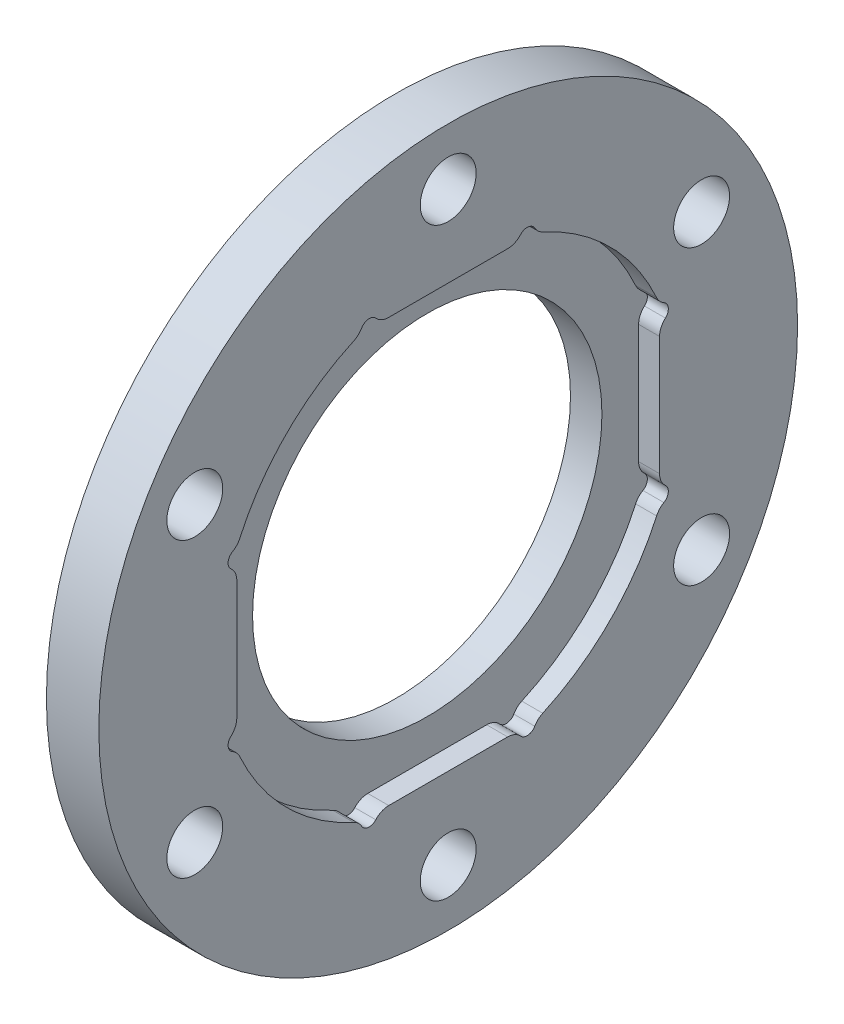
from build123d import *

# Parameters (mm, degrees)
SKETCH_3_R          = 20
EXTRUDE_3_DEPTH     = 3
SKETCH_4_R          = 13.1
CUT_EXTRUDE_1_DEPTH = 1.2
EXTRUDE_START       = 1.2
EXTRUDE_4_DEPTH     = 1.2
SKETCH_6_R          = 10
CUT_EXTRUDE_2_DEPTH = 29.341489022
SKETCH_7_R          = 1.6
CUT_EXTRUDE_4_DEPTH = 29.442925307
SKETCH_8_R          = 0.5
CUT_EXTRUDE_5_DEPTH = 1.2
FILLET_START        = 1.8
FILLET_1_DEPTH      = 2.2


with BuildPart() as part:
    # 草图3 → 凸台-拉伸3 (new body)
    with BuildSketch(Plane(origin=(0, 0, 0), x_dir=(0, 0, -1), z_dir=(1, 0, 0))):
        Circle(SKETCH_3_R)
    extrude(amount=EXTRUDE_3_DEPTH)

    # 草图4 → 切除-拉伸1 (cut)
    with BuildSketch(Plane(origin=(3, 0, 0), x_dir=(0, 0, -1), z_dir=(1, 0, 0))):
        Circle(SKETCH_4_R)
    extrude(amount=-CUT_EXTRUDE_1_DEPTH, mode=Mode.SUBTRACT)

    # 草图5 → 凸台-拉伸4 (add)
    with BuildSketch(Plane(origin=(1.8, 0, 0), x_dir=(0, 0, -1), z_dir=(1, 0, 0)).offset(EXTRUDE_START)):
        with BuildLine():
            Line((-5.019960159, 12.1), (5.019960159, 12.1))
            ThreePointArc((5.019960159, 12.1), (0, 13.1), (-5.019960159, 12.1))
        make_face()
        with BuildLine():
            Line((-12.1, 5.019960159), (-12.1, -5.019960159))
            ThreePointArc((-12.1, -5.019960159), (-13.1, 0), (-12.1, 5.019960159))
        make_face()
        with BuildLine():
            Line((-5.019960159, -12.1), (5.019960159, -12.1))
            ThreePointArc((5.019960159, -12.1), (0, -13.1), (-5.019960159, -12.1))
        make_face()
        with BuildLine():
            Line((12.1, 5.019960159), (12.1, -5.019960159))
            ThreePointArc((12.1, -5.019960159), (13.1, 0), (12.1, 5.019960159))
        make_face()
    extrude(amount=-EXTRUDE_4_DEPTH)

    # 草图6 → 切除-拉伸2 (cut, through all)
    with BuildSketch(Plane(origin=(1.8, 0, 0), x_dir=(0, 0, -1), z_dir=(1, 0, 0))):
        Circle(SKETCH_6_R)
    extrude(amount=-CUT_EXTRUDE_2_DEPTH, mode=Mode.SUBTRACT)

    # 草图7 → 切除-拉伸4 (cut, through all)
    with BuildSketch(Plane(origin=(3, 0, 0), x_dir=(0, 0, -1), z_dir=(1, 0, 0))):
        with Locations((0, 16.75)):
            Circle(SKETCH_7_R)
        with Locations((14.505925513, 8.375)):
            Circle(SKETCH_7_R)
        with Locations((14.505925513, -8.375)):
            Circle(SKETCH_7_R)
        with Locations((0, -16.75)):
            Circle(SKETCH_7_R)
        with Locations((-14.505925513, -8.375)):
            Circle(SKETCH_7_R)
        with Locations((-14.505925513, 8.375)):
            Circle(SKETCH_7_R)
    extrude(amount=-CUT_EXTRUDE_4_DEPTH, mode=Mode.SUBTRACT)

    # 草图8 → 切除-拉伸5 (cut)
    with BuildSketch(Plane(origin=(3, 0, 0), x_dir=(0, 0, -1), z_dir=(1, 0, 0))):
        with Locations((-4.519960159, 12.1)):
            Circle(SKETCH_8_R)
        with Locations((12.1, 4.519960159)):
            Circle(SKETCH_8_R)
        with Locations((4.519960159, -12.1)):
            Circle(SKETCH_8_R)
        with Locations((-12.1, -4.519960159)):
            Circle(SKETCH_8_R)
        with Locations((4.519960159, 12.1)):
            Circle(SKETCH_8_R)
        with Locations((12.1, -4.519960159)):
            Circle(SKETCH_8_R)
        with Locations((-4.519960159, -12.1)):
            Circle(SKETCH_8_R)
        with Locations((-12.1, 4.519960159)):
            Circle(SKETCH_8_R)
    extrude(amount=-CUT_EXTRUDE_5_DEPTH, mode=Mode.SUBTRACT)

    # 圆角1: read off the stored shape, not the designer's step
    # 圆角1 outline → 圆角1 (cut)
    with BuildSketch(Plane.YZ.offset(FILLET_START)):
        with BuildLine():
            ThreePointArc((3.40192617, -12.1), (3.810174461, -12.187129071), (4.147282163, -12.433333333))
            ThreePointArc((4.147282163, -12.433333333), (4.05287398, -12.278411045), (4.019960159, -12.1))
            Line((4.019960159, -12.1), (3.40192617, -12.1))
        make_face()
        with BuildLine():
            ThreePointArc((5.019960159, -12.1), (5.003372821, -12.227719215), (4.954711368, -12.346964343))
            ThreePointArc((4.954711368, -12.346964343), (5.149921864, -12.102428131), (5.411148977, -11.930191396))
            ThreePointArc((5.411148977, -11.930191396), (5.216245603, -12.016687639), (5.019960159, -12.1))
        make_face()
        with BuildLine():
            ThreePointArc((-4.147282163, -12.433333333), (-3.810174461, -12.187129071), (-3.40192617, -12.1))
            Line((-3.40192617, -12.1), (-4.019960159, -12.1))
            ThreePointArc((-4.019960159, -12.1), (-4.05287398, -12.278411045), (-4.147282163, -12.433333333))
        make_face()
        with BuildLine():
            ThreePointArc((12.1, -5.019960159), (12.016687639, -5.216245603), (11.930191396, -5.411148977))
            ThreePointArc((11.930191396, -5.411148977), (12.102428131, -5.149921864), (12.346964343, -4.954711368))
            ThreePointArc((12.346964343, -4.954711368), (12.227719215, -5.003372821), (12.1, -5.019960159))
        make_face()
        with BuildLine():
            ThreePointArc((-5.411148977, -11.930191396), (-5.149921864, -12.102428131), (-4.954711368, -12.346964343))
            ThreePointArc((-4.954711368, -12.346964343), (-5.003372821, -12.227719215), (-5.019960159, -12.1))
            ThreePointArc((-5.019960159, -12.1), (-5.216245603, -12.016687639), (-5.411148977, -11.930191396))
        make_face()
        with BuildLine():
            ThreePointArc((12.1, -4.019960159), (12.278411045, -4.05287398), (12.433333333, -4.147282163))
            ThreePointArc((12.433333333, -4.147282163), (12.187129071, -3.810174461), (12.1, -3.40192617))
            Line((12.1, -3.40192617), (12.1, -4.019960159))
        make_face()
        with BuildLine():
            ThreePointArc((-12.346964343, -4.954711368), (-12.102428131, -5.149921864), (-11.930191396, -5.411148977))
            ThreePointArc((-11.930191396, -5.411148977), (-12.016687639, -5.216245603), (-12.1, -5.019960159))
            ThreePointArc((-12.1, -5.019960159), (-12.227719215, -5.003372821), (-12.346964343, -4.954711368))
        make_face()
        with BuildLine():
            Line((12.1, 4.019960159), (12.1, 3.40192617))
            ThreePointArc((12.1, 3.40192617), (12.187129071, 3.810174461), (12.433333333, 4.147282163))
            ThreePointArc((12.433333333, 4.147282163), (12.278411045, 4.05287398), (12.1, 4.019960159))
        make_face()
        with BuildLine():
            ThreePointArc((-12.1, -3.40192617), (-12.187129071, -3.810174461), (-12.433333333, -4.147282163))
            ThreePointArc((-12.433333333, -4.147282163), (-12.278411045, -4.05287398), (-12.1, -4.019960159))
            Line((-12.1, -4.019960159), (-12.1, -3.40192617))
        make_face()
        with BuildLine():
            ThreePointArc((12.1, 5.019960159), (12.227719215, 5.003372821), (12.346964343, 4.954711368))
            ThreePointArc((12.346964343, 4.954711368), (12.102428131, 5.149921864), (11.930191396, 5.411148977))
            ThreePointArc((11.930191396, 5.411148977), (12.016687639, 5.216245603), (12.1, 5.019960159))
        make_face()
        with BuildLine():
            ThreePointArc((-12.433333333, 4.147282163), (-12.187129071, 3.810174461), (-12.1, 3.40192617))
            Line((-12.1, 3.40192617), (-12.1, 4.019960159))
            ThreePointArc((-12.1, 4.019960159), (-12.278411045, 4.05287398), (-12.433333333, 4.147282163))
        make_face()
        with BuildLine():
            ThreePointArc((5.019960159, 12.1), (5.216245603, 12.016687639), (5.411148977, 11.930191396))
            ThreePointArc((5.411148977, 11.930191396), (5.149921864, 12.102428131), (4.954711368, 12.346964343))
            ThreePointArc((4.954711368, 12.346964343), (5.003372821, 12.227719215), (5.019960159, 12.1))
        make_face()
        with BuildLine():
            ThreePointArc((-11.930191396, 5.411148977), (-12.102428131, 5.149921864), (-12.346964343, 4.954711368))
            ThreePointArc((-12.346964343, 4.954711368), (-12.227719215, 5.003372821), (-12.1, 5.019960159))
            ThreePointArc((-12.1, 5.019960159), (-12.016687639, 5.216245603), (-11.930191396, 5.411148977))
        make_face()
        with BuildLine():
            ThreePointArc((4.019960159, 12.1), (4.05287398, 12.278411045), (4.147282163, 12.433333333))
            ThreePointArc((4.147282163, 12.433333333), (3.810174461, 12.187129071), (3.40192617, 12.1))
            Line((3.40192617, 12.1), (4.019960159, 12.1))
        make_face()
        with BuildLine():
            ThreePointArc((-4.954711368, 12.346964343), (-5.149921864, 12.102428131), (-5.411148977, 11.930191396))
            ThreePointArc((-5.411148977, 11.930191396), (-5.216245603, 12.016687639), (-5.019960159, 12.1))
            ThreePointArc((-5.019960159, 12.1), (-5.003372821, 12.227719215), (-4.954711368, 12.346964343))
        make_face()
        with BuildLine():
            Line((-4.019960159, 12.1), (-3.40192617, 12.1))
            ThreePointArc((-3.40192617, 12.1), (-3.810174461, 12.187129071), (-4.147282163, 12.433333333))
            ThreePointArc((-4.147282163, 12.433333333), (-4.05287398, 12.278411045), (-4.019960159, 12.1))
        make_face()
    extrude(amount=FILLET_1_DEPTH, mode=Mode.SUBTRACT)


solid = part.part
